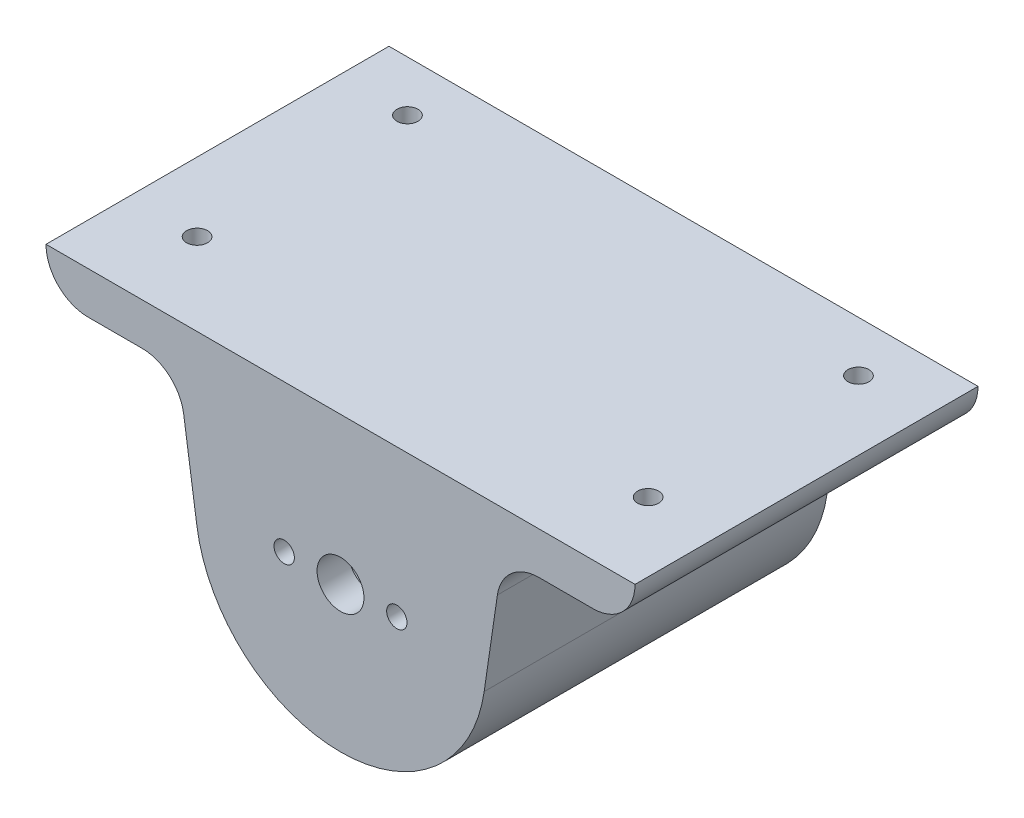
from build123d import *

# Parameters (mm, degrees)
SKETCH1_R           = 12.5381004
BOSS_EXTRUDE1_DEPTH = 47
SKETCH2_W           = 88.9
SKETCH2_H           = 47
BOSS_EXTRUDE2_DEPTH = 6.35
FILLET1_R           = 6.35
SKETCH3_R           = 1.5875
CUT_EXTRUDE1_DEPTH  = 9.525
BOSS_EXTRUDE3_START = 4.7625
SKETCH5_R           = 3.5381057
SKETCH5_R_2         = 1.538097
BOSS_EXTRUDE3_DEPTH = 4.7625


with BuildPart() as part:
    # Sketch1 → Boss-Extrude1 (new body)
    with BuildSketch(Plane.XY):
        with BuildLine():
            Line((-25.4, 22.225), (25.4, 22.225))
            Line((25.4, 22.225), (21.680256121, -3.175))
            ThreePointArc((21.680256121, -3.175), (0, -21.911506805), (-21.680256121, -3.175))
            Line((-21.680256121, -3.175), (-25.4, 22.225))
        make_face()
        Circle(SKETCH1_R, mode=Mode.SUBTRACT)
    extrude(amount=-BOSS_EXTRUDE1_DEPTH)

    # Sketch2 → Boss-Extrude2 (add)
    with BuildSketch(Plane(origin=(0, 22.225, 0), x_dir=(1, 0, 0), z_dir=(0, 1, 0))):
        with Locations((0, 23.5)):
            Rectangle(SKETCH2_W, SKETCH2_H)
    extrude(amount=-BOSS_EXTRUDE2_DEPTH)

    # Fillet1
    fillet1_edges = [part.edges().sort_by_distance(p)[0] for p in [
        (44.45, 15.875, -23.5),
        (-44.45, 15.875, -23.5),
        (24.47006403, 15.875, -23.5),
        (-24.47006403, 15.875, -23.5),
    ]]
    fillet(fillet1_edges, radius=FILLET1_R - 0.0001)  # a hair under: the kernel refuses the full size

    # Sketch3 → Cut-Extrude1 (cut)
    with BuildSketch(Plane.XZ.offset(-15.875)):
        with Locations(Location((-34.036, -7.625, 0), (0, 0, 270))):
            Circle(SKETCH3_R)
        with Locations(Location((-34.036, -39.375, 0), (0, 0, 270))):
            Circle(SKETCH3_R)
        with Locations(Location((34.036, -39.375, 0), (0, 0, 270))):
            Circle(SKETCH3_R)
        with Locations(Location((34.036, -7.625, 0), (0, 0, 270))):
            Circle(SKETCH3_R)
    extrude(amount=-CUT_EXTRUDE1_DEPTH, mode=Mode.SUBTRACT)

    # Sketch5 → Boss-Extrude3 (add)
    with BuildSketch(Plane.XY.offset(BOSS_EXTRUDE3_START)):
        with BuildLine():
            Line((29.957859818, 15.875), (38.1, 15.875))
            ThreePointArc((38.1, 15.875), (42.590128061, 17.734871939), (44.45, 22.225))
            Line((44.45, 22.225), (-44.45, 22.225))
            ThreePointArc((-44.45, 22.225), (-42.590128061, 17.734871939), (-38.1, 15.875))
            Line((-38.1, 15.875), (-29.957859818, 15.875))
            ThreePointArc((-29.957859818, 15.875), (-25.805768294, 14.329439195), (-23.674876744, 10.445121568))
            Line((-23.674876744, 10.445121568), (-21.680256121, -3.175))
            ThreePointArc((-21.680256121, -3.175), (0, -21.911506805), (21.680256121, -3.175))
            Line((21.680256121, -3.175), (23.674876744, 10.445121568))
            ThreePointArc((23.674876744, 10.445121568), (25.805768294, 14.329439195), (29.957859818, 15.875))
        make_face()
        with Locations(Location((0, 0, 0), (0, 0, 180))):
            Circle(SKETCH5_R, mode=Mode.SUBTRACT)
        with Locations(Location((-8.5, 0, 0), (0, 0, 180))):
            Circle(SKETCH5_R_2, mode=Mode.SUBTRACT)
        with Locations(Location((8.5, 0, 0), (0, 0, 180))):
            Circle(SKETCH5_R_2, mode=Mode.SUBTRACT)
    extrude(amount=-BOSS_EXTRUDE3_DEPTH)


solid = part.part
